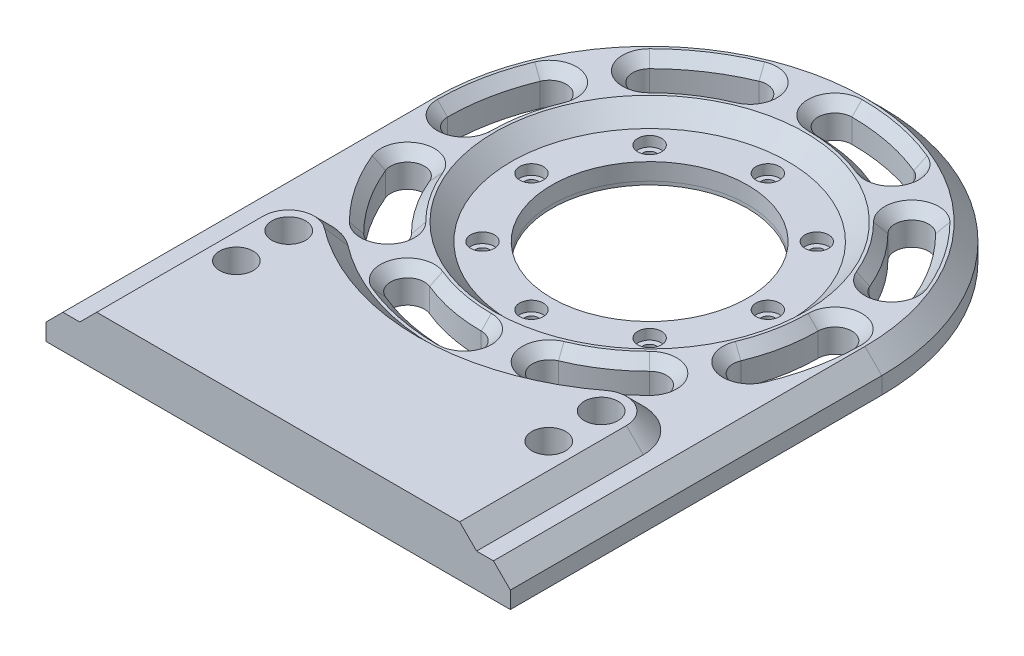
from build123d import *
from build123d.topology import SkipClean

# Parameters (mm, degrees)
SKETCH1_R           = 40
SKETCH1_R_2         = 2
SKETCH1_R_3         = 29
BOSS_EXTRUDE1_DEPTH = 11
BOSS_EXTRUDE2_START = -10
SKETCH3_R           = 40
BOSS_EXTRUDE2_DEPTH = 10
SKETCH4_R           = 41
CUT_EXTRUDE2_DEPTH  = 5
CHAMFER2_SIZE       = 5
CHAMFER4_SIZE       = 5
CUT_EXTRUDE4_DEPTH  = 15
CHAMFER5_SIZE       = 3
SKETCH8_R           = 3.5
CUT_EXTRUDE5_DEPTH  = 3
BOSS_EXTRUDE3_DEPTH = 5
CHAMFER6_SIZE       = 5
BOSS_EXTRUDE4_DEPTH = 10
SKETCH14_R          = 5.5
CUT_EXTRUDE6_DEPTH  = 13
SKETCH15_R          = 5.5
SKETCH15_R_2        = 5
BOSS_EXTRUDE5_DEPTH = 13


# Read off the part's stored shape, not the designer's step: Intersect1
with BuildPart() as part:
    # Sketch1 → Boss-Extrude1 (new body)
    with BuildSketch(Plane(origin=(0, 0, 0), x_dir=(1, 0, 0), z_dir=(0, 1, 0))):
        with Locations(Location((0, 0, 0), (0, 0, 270))):
            Circle(SKETCH1_R)
        with Locations(Location((35, 0, 0), (0, 0, 270))):
            Circle(SKETCH1_R_2, mode=Mode.SUBTRACT)
        with Locations(Location((24.748737342, -24.748737342, 0), (0, 0, 270))):
            Circle(SKETCH1_R_2, mode=Mode.SUBTRACT)
        with Locations(Location((0, -35, 0), (0, 0, 270))):
            Circle(SKETCH1_R_2, mode=Mode.SUBTRACT)
        with Locations(Location((-24.748737342, -24.748737342, 0), (0, 0, 270))):
            Circle(SKETCH1_R_2, mode=Mode.SUBTRACT)
        with Locations(Location((-35, 0, 0), (0, 0, 270))):
            Circle(SKETCH1_R_2, mode=Mode.SUBTRACT)
        with Locations(Location((-24.748737342, 24.748737342, 0), (0, 0, 270))):
            Circle(SKETCH1_R_2, mode=Mode.SUBTRACT)
        with Locations(Location((0, 35, 0), (0, 0, 270))):
            Circle(SKETCH1_R_2, mode=Mode.SUBTRACT)
        with Locations(Location((24.748737342, 24.748737342, 0), (0, 0, 270))):
            Circle(SKETCH1_R_2, mode=Mode.SUBTRACT)
        with Locations(Location((0, 0, 0), (0, 0, 270))):
            Circle(SKETCH1_R_3, mode=Mode.SUBTRACT)
    extrude(amount=BOSS_EXTRUDE1_DEPTH)

    # Sketch3 → Boss-Extrude2 (add)
    with BuildSketch(Plane(origin=(0, 11, 0), x_dir=(1, 0, 0), z_dir=(0, 1, 0)).offset(BOSS_EXTRUDE2_START)):
        with BuildLine():
            Line((68.75, 0), (68.75, -100))
            Line((68.75, -100), (0, -100))
            Line((0, -100), (-68.75, -100))
            Line((-68.75, -100), (-68.75, 0))
            ThreePointArc((-68.75, 0), (0, 68.75), (68.75, 0))
        make_face()
        with Locations(Location((0, 0, 0), (0, 0, 270))):
            Circle(SKETCH3_R, mode=Mode.SUBTRACT)
    extrude(amount=BOSS_EXTRUDE2_DEPTH)

    # Sketch4 → Cut-Extrude2 (cut)
    with BuildSketch(Plane(origin=(0, 11, 0), x_dir=(1, 0, 0), z_dir=(0, 1, 0))):
        with Locations(Location((0, 0, 0), (0, 0, 270))):
            Circle(SKETCH4_R)
    extrude(amount=-CUT_EXTRUDE2_DEPTH, mode=Mode.SUBTRACT)

    # Chamfer2
    chamfer2_edges = [part.edges().sort_by_distance(p)[0] for p in [
        (0, 11, -41),
    ]]
    chamfer(chamfer2_edges, length=CHAMFER2_SIZE - 0.0001)  # a hair under: the kernel refuses the full size

    # Chamfer4
    chamfer4_edges = [part.edges().sort_by_distance(p)[0] for p in [
        (68.75, 11, 50),
        (0, 11, -68.75),
        (-68.75, 11, 50),
    ]]
    chamfer(chamfer4_edges, length=CHAMFER4_SIZE)

    # Sketch7 → Cut-Extrude4 (cut)
    with BuildSketch(Plane(origin=(0, 11, 0), x_dir=(1, 0, 0), z_dir=(0, 1, 0))):
        with BuildLine():
            ThreePointArc((-55.317287009, 22.913170513), (-58.724518664, 11.681033031), (-59.875, 0))
            ThreePointArc((-59.875, 0), (-54.875, -5), (-49.875, 0))
            ThreePointArc((-49.875, 0), (-48.91666586, 9.730129811), (-46.078491684, 19.086336189))
            ThreePointArc((-46.078491684, 19.086336189), (-48.784472185, 25.619151014), (-55.317287009, 22.913170513))
        make_face()
        with BuildLine():
            ThreePointArc((-22.913170513, 55.317287009), (-33.264767702, 49.784243037), (-42.338018524, 42.338018524))
            ThreePointArc((-42.338018524, 42.338018524), (-42.338018524, 35.266950712), (-35.266950712, 35.266950712))
            ThreePointArc((-35.266950712, 35.266950712), (-27.709065372, 41.469546914), (-19.086336189, 46.078491684))
            ThreePointArc((-19.086336189, 46.078491684), (-16.380355688, 52.611306508), (-22.913170513, 55.317287009))
        make_face()
        with BuildLine():
            ThreePointArc((22.913170513, 55.317287009), (11.681033031, 58.724518664), (0, 59.875))
            ThreePointArc((0, 59.875), (-5, 54.875), (0, 49.875))
            ThreePointArc((0, 49.875), (9.730129811, 48.91666586), (19.086336189, 46.078491684))
            ThreePointArc((19.086336189, 46.078491684), (25.619151014, 48.784472185), (22.913170513, 55.317287009))
        make_face()
        with BuildLine():
            ThreePointArc((55.317287009, 22.913170513), (49.784243037, 33.264767702), (42.338018524, 42.338018524))
            ThreePointArc((42.338018524, 42.338018524), (35.266950712, 42.338018524), (35.266950712, 35.266950712))
            ThreePointArc((35.266950712, 35.266950712), (41.469546914, 27.709065372), (46.078491684, 19.086336189))
            ThreePointArc((46.078491684, 19.086336189), (52.611306508, 16.380355688), (55.317287009, 22.913170513))
        make_face()
        with BuildLine():
            ThreePointArc((55.317287009, -22.913170513), (58.724518664, -11.681033031), (59.875, 0))
            ThreePointArc((59.875, 0), (54.875, 5), (49.875, 0))
            ThreePointArc((49.875, 0), (48.91666586, -9.730129811), (46.078491684, -19.086336189))
            ThreePointArc((46.078491684, -19.086336189), (48.784472185, -25.619151014), (55.317287009, -22.913170513))
        make_face()
        with BuildLine():
            ThreePointArc((22.913170513, -55.317287009), (33.264767702, -49.784243037), (42.338018524, -42.338018524))
            ThreePointArc((42.338018524, -42.338018524), (42.338018524, -35.266950712), (35.266950712, -35.266950712))
            ThreePointArc((35.266950712, -35.266950712), (27.709065372, -41.469546914), (19.086336189, -46.078491684))
            ThreePointArc((19.086336189, -46.078491684), (16.380355688, -52.611306508), (22.913170513, -55.317287009))
        make_face()
        with BuildLine():
            ThreePointArc((-22.913170513, -55.317287009), (-11.681033031, -58.724518664), (0, -59.875))
            ThreePointArc((0, -59.875), (5, -54.875), (0, -49.875))
            ThreePointArc((0, -49.875), (-9.730129811, -48.91666586), (-19.086336189, -46.078491684))
            ThreePointArc((-19.086336189, -46.078491684), (-25.619151014, -48.784472185), (-22.913170513, -55.317287009))
        make_face()
        with BuildLine():
            ThreePointArc((-55.317287009, -22.913170513), (-49.784243037, -33.264767702), (-42.338018524, -42.338018524))
            ThreePointArc((-42.338018524, -42.338018524), (-35.266950712, -42.338018524), (-35.266950712, -35.266950712))
            ThreePointArc((-35.266950712, -35.266950712), (-41.469546914, -27.709065372), (-46.078491684, -19.086336189))
            ThreePointArc((-46.078491684, -19.086336189), (-52.611306508, -16.380355688), (-55.317287009, -22.913170513))
        make_face()
    extrude(amount=-CUT_EXTRUDE4_DEPTH, mode=Mode.SUBTRACT)

    # Chamfer5
    chamfer5_edges = [part.edges().sort_by_distance(p)[0] for p in [
        (9.730129811, 11, -48.91666586),
        (25.619151014, 11, -48.784472185),
        (11.681033031, 11, -58.724518664),
        (-5, 11, -54.875),
        (41.469546914, 11, -27.709065372),
        (52.611306508, 11, -16.380355688),
        (49.784243037, 11, -33.264767702),
        (35.266950712, 11, -42.338018524),
        (48.91666586, 11, 9.730129811),
        (48.784472185, 11, 25.619151014),
        (58.724518664, 11, 11.681033031),
        (54.875, 11, -5),
        (27.709065372, 11, 41.469546914),
        (16.380355688, 11, 52.611306508),
        (33.264767702, 11, 49.784243037),
        (42.338018524, 11, 35.266950712),
        (-9.730129811, 11, 48.91666586),
        (-25.619151014, 11, 48.784472185),
        (-11.681033031, 11, 58.724518664),
        (5, 11, 54.875),
        (-41.469546914, 11, 27.709065372),
        (-52.611306508, 11, 16.380355688),
        (-49.784243037, 11, 33.264767702),
        (-35.266950712, 11, 42.338018524),
        (-48.91666586, 11, -9.730129811),
        (-48.784472185, 11, -25.619151014),
        (-58.724518664, 11, -11.681033031),
        (-54.875, 11, 5),
        (-27.709065372, 11, -41.469546914),
        (-16.380355688, 11, -52.611306508),
        (-33.264767702, 11, -49.784243037),
        (-42.338018524, 11, -35.266950712),
    ]]
    chamfer(chamfer5_edges, length=CHAMFER5_SIZE)

    # Sketch8 → Cut-Extrude5 (cut)
    with BuildSketch(Plane(origin=(0, 6, 0), x_dir=(1, 0, 0), z_dir=(0, 1, 0))):
        with Locations(Location((-35, 0, 0), (0, 0, 270))):
            Circle(SKETCH8_R)
        with Locations(Location((-24.748737342, 24.748737342, 0), (0, 0, 270))):
            Circle(SKETCH8_R)
        with Locations(Location((0, 35, 0), (0, 0, 270))):
            Circle(SKETCH8_R)
        with Locations(Location((24.748737342, 24.748737342, 0), (0, 0, 270))):
            Circle(SKETCH8_R)
        with Locations(Location((35, 0, 0), (0, 0, 270))):
            Circle(SKETCH8_R)
        with Locations(Location((24.748737342, -24.748737342, 0), (0, 0, 270))):
            Circle(SKETCH8_R)
        with Locations(Location((0, -35, 0), (0, 0, 270))):
            Circle(SKETCH8_R)
        with Locations(Location((-24.748737342, -24.748737342, 0), (0, 0, 270))):
            Circle(SKETCH8_R)
    extrude(amount=-CUT_EXTRUDE5_DEPTH, mode=Mode.SUBTRACT)

    # Sketch9 → Boss-Extrude3 (add)
    with BuildSketch(Plane(origin=(0, 11, 0), x_dir=(1, 0, 0), z_dir=(0, 1, 0))):
        with BuildLine():
            Line((-53.75, -60.621778265), (-53.75, -100))
            Line((-53.75, -100), (0, -100))
            Line((0, -100), (0, -68.75))
            ThreePointArc((0, -68.75), (-22.008607377, -65.132048189), (-41.700819672, -54.658980403))
            ThreePointArc((-41.700819672, -54.658980403), (-49.576495719, -53.899842068), (-53.75, -60.621778265))
        make_face()
        with BuildLine():
            Line((0, -68.75), (0, -100))
            Line((0, -100), (53.75, -100))
            Line((53.75, -100), (53.75, -60.621778265))
            ThreePointArc((53.75, -60.621778265), (49.576495719, -53.899842068), (41.700819672, -54.658980403))
            ThreePointArc((41.700819672, -54.658980403), (22.008607377, -65.132048189), (0, -68.75))
        make_face()
    extrude(amount=BOSS_EXTRUDE3_DEPTH)

    # Chamfer6
    chamfer6_edges = [part.edges().sort_by_distance(p)[0] for p in [
        (53.75, 11, 80.310889132),
        (49.576495719, 11, 53.899842068),
        (0, 11, 68.75),
        (-49.576495719, 11, 53.899842068),
        (-53.75, 11, 80.310889132),
    ]]
    chamfer(chamfer6_edges, length=CHAMFER6_SIZE - 0.0001)  # a hair under: the kernel refuses the full size


with BuildPart() as body_2:
    # Intersect1: the piece on the far side of the plane
    add(part.part)
    split(bisect_by=Plane(origin=(0, 1, 0), x_dir=(1, 0, 0), z_dir=(0, 1, 0)), keep=Keep.BOTTOM)


with BuildPart() as part_1:
    add(part.part)

    # Intersect1
    split(bisect_by=Plane(origin=(0, 1, 0), x_dir=(1, 0, 0), z_dir=(0, 1, 0)), keep=Keep.TOP)

    # Sketch11 → Boss-Extrude4 (add)
    with SkipClean():  # the faces are left unmerged after this step: merging them gives an invalid solid
        with BuildSketch(Plane.XY.offset(100)):
            Polygon((-68.75, 1), (-68.75, 6), (-63.75, 11), (-58.75, 11), (-53.75, 16), (53.75, 16), (58.75, 11), (63.75, 11), (68.75, 6), (68.75, 1), align=None)
        extrude(amount=BOSS_EXTRUDE4_DEPTH)

    # Sketch14 → Cut-Extrude6 (cut)
    with SkipClean():  # the faces are left unmerged after this step: merging them gives an invalid solid
        with BuildSketch(Plane(origin=(0, 16, 0), x_dir=(1, 0, 0), z_dir=(0, 1, 0))):
            with Locations(Location((-46.25, -60.621778265, 0), (0, 0, 270))):
                Circle(SKETCH14_R)
            with Locations(Location((46.25, -60.621778265, 0), (0, 0, 270))):
                Circle(SKETCH14_R)
            with Locations(Location((-46.25, -76.121778265, 0), (0, 0, 270))):
                Circle(SKETCH14_R)
            with Locations(Location((46.25, -76.121778265, 0), (0, 0, 270))):
                Circle(SKETCH14_R)
        extrude(amount=-CUT_EXTRUDE6_DEPTH, mode=Mode.SUBTRACT)

    # Sketch15 → Boss-Extrude5 (add)
    # profile 1 of 4: a face of its own
    with SkipClean():  # the faces are left unmerged after this step: merging them gives an invalid solid
        with BuildSketch(Plane(origin=(0, 16, 0), x_dir=(1, 0, 0), z_dir=(0, 1, 0))):
            with Locations((46.25, -60.621778265)):
                Circle(SKETCH15_R)
            with Locations(Location((46.25, -60.621778265, 0), (0, 0, 270))):
                Circle(SKETCH15_R_2, mode=Mode.SUBTRACT)
        # profile 2 of 4: a face of its own
        with BuildSketch(Plane(origin=(0, 16, 0), x_dir=(1, 0, 0), z_dir=(0, 1, 0))):
            with Locations((46.25, -76.121778265)):
                Circle(SKETCH15_R)
            with Locations(Location((46.25, -76.121778265, 0), (0, 0, 270))):
                Circle(SKETCH15_R_2, mode=Mode.SUBTRACT)
        # profile 3 of 4: a face of its own
        with BuildSketch(Plane(origin=(0, 16, 0), x_dir=(1, 0, 0), z_dir=(0, 1, 0))):
            with Locations((-46.25, -76.121778265)):
                Circle(SKETCH15_R)
            with Locations(Location((-46.25, -76.121778265, 0), (0, 0, 270))):
                Circle(SKETCH15_R_2, mode=Mode.SUBTRACT)
        # profile 4 of 4: a face of its own
        with BuildSketch(Plane(origin=(0, 16, 0), x_dir=(1, 0, 0), z_dir=(0, 1, 0))):
            with Locations((-46.25, -60.621778265)):
                Circle(SKETCH15_R)
            with Locations(Location((-46.25, -60.621778265, 0), (0, 0, 270))):
                Circle(SKETCH15_R_2, mode=Mode.SUBTRACT)
        extrude(amount=-BOSS_EXTRUDE5_DEPTH)


solid = Compound([body_2.part, part_1.part])
